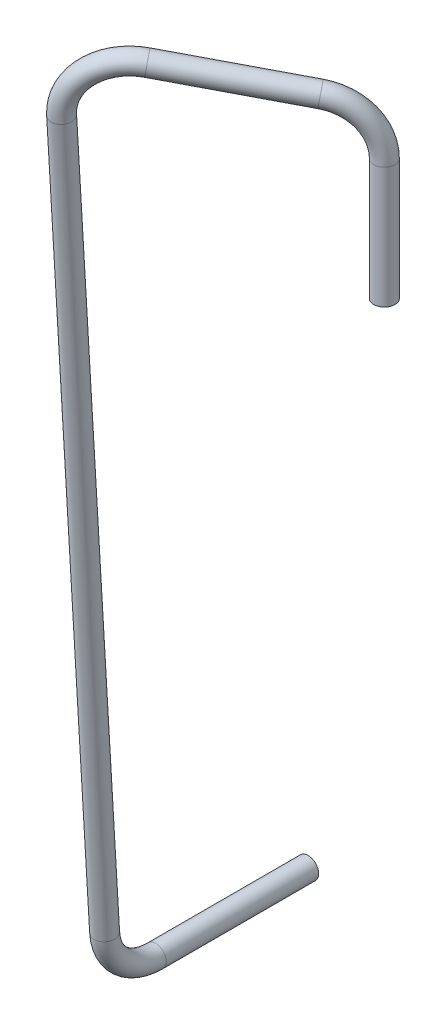
from build123d import *

# Parameters (mm, degrees)
SWEEP_SOTTILE2_PROFILE_R   = 1.585
SWEEP_SOTTILE2_PROFILE_R_2 = 1.085


with BuildPart() as part:
    # Sweep-Sottile2: sweep along a curve in space
    with BuildLine() as sweep_sottile2_path:
        Line((0, 0, 0), (0, 18.127410745, 0))
        ThreePointArc((0, 18.127410745, 0), (-1.490951839, 23.340492786, 1.228284678), (-5.243774412, 26.035994644, 4.319956954))
        Line((-5.243774412, 26.035994644, 4.319956954), (-19.449428273, 28.842557275, 16.022941934))
        ThreePointArc((-19.449428273, 28.842557275, 16.022941934), (-24.665337869, 26.943364665, 19.918970251), (-27.191531065, 20.758738002, 21.08534203))
        Line((-27.191531065, 20.758738002, 21.08534203), (-32.310949634, -93.456386342, 9.532293275))
        ThreePointArc((-32.310949634, -93.456386342, 9.532293275), (-32.540663603, -98.581345189, 6.937785997), (-32.633155846, -100.64486334, 1.57282768))
        Line((-32.633155846, -100.64486334, 1.57282768), (-32.633155846, -100.64486334, -21.222828084))
    # Sweep-Sottile2 profile (on start of the path) → Sweep-Sottile2 (sweep)
    with BuildSketch(Plane.ZX):
        Circle(SWEEP_SOTTILE2_PROFILE_R)
        Circle(SWEEP_SOTTILE2_PROFILE_R_2, mode=Mode.SUBTRACT)
    sweep(path=sweep_sottile2_path.line)


solid = part.part
